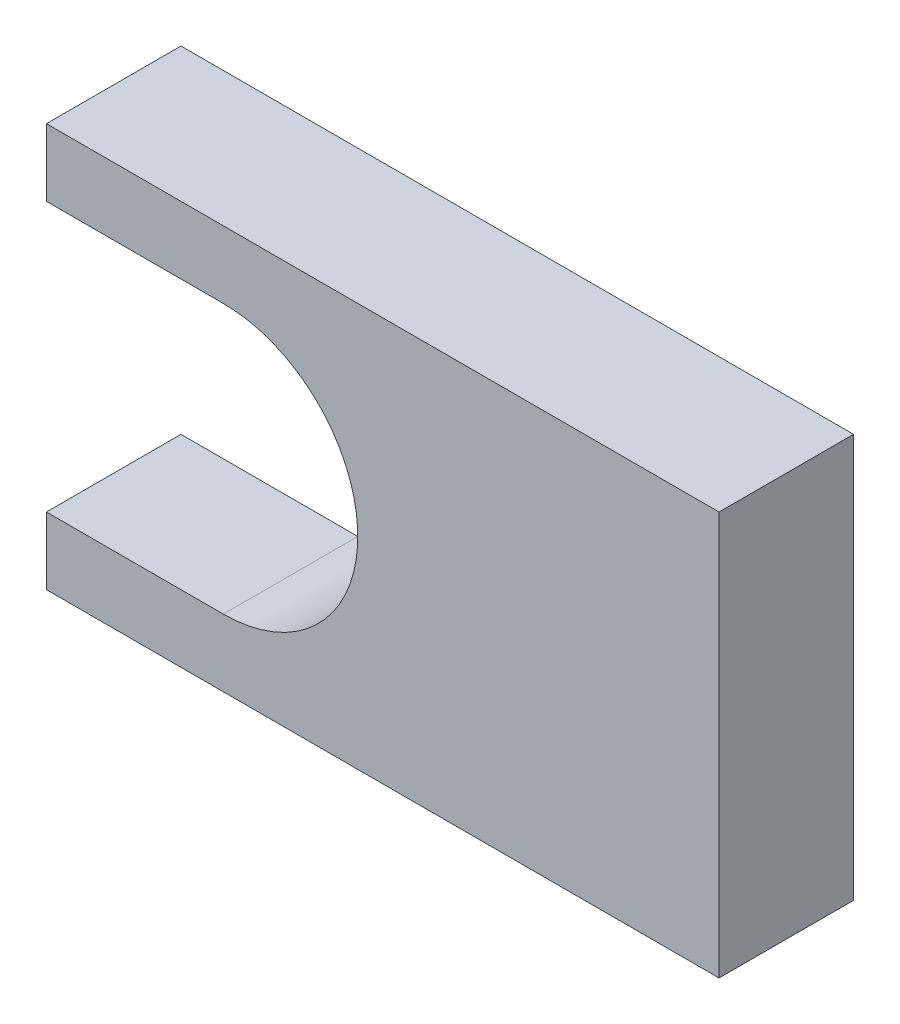
from build123d import *

# Parameters (mm, degrees)
BOSS_EXTRUDE1_DEPTH = 10


with BuildPart() as part:
    # Sketch1 → Boss-Extrude1 (new body)
    with BuildSketch(Plane.XY):
        with BuildLine():
            Line((-13.14596048, 5), (36.85403952, 5))
            Line((36.85403952, 5), (36.85403952, -25))
            Line((36.85403952, -25), (-13.14596048, -25))
            Line((-13.14596048, -25), (-13.14596048, -20))
            Line((-13.14596048, -20), (0, -20))
            ThreePointArc((0, -20), (10, -10), (0, 0))
            Line((0, 0), (-13.14596048, 0))
            Line((-13.14596048, 0), (-13.14596048, 5))
        make_face()
    extrude(amount=BOSS_EXTRUDE1_DEPTH)


solid = part.part
